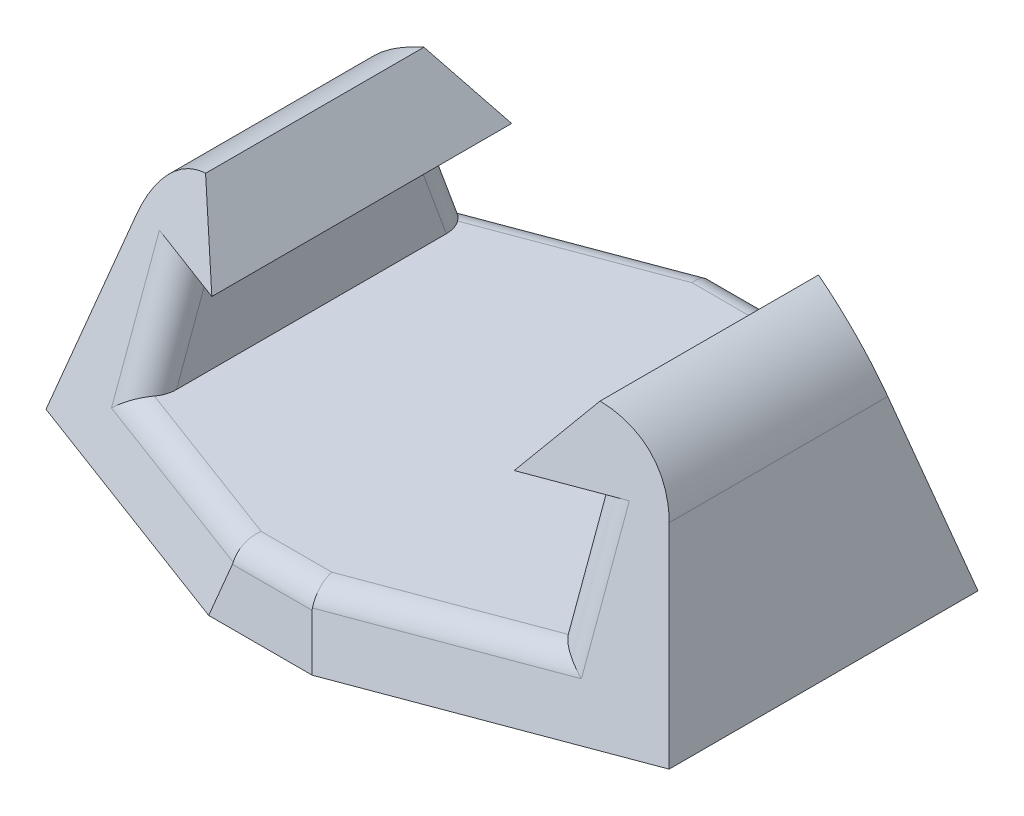
from build123d import *

# Parameters (mm, degrees)
EXTRUDE_1_DEPTH          = 20
CUT_EXTRUDE_1_DEPTH      = 26.52668646
CUT_EXTRUDE_1_DEPTH_BACK = 26.52668646
FILLET_1_R               = 4
CHAMFER_1_SIZE           = 10
CHAMFER_1_SIZE_2         = 3.739269956
FILLET_2_R               = 1


with BuildPart() as part:
    # 草圖2 → 填料-伸長1 (new body)
    with BuildSketch(Plane.XY):
        Polygon((-8.195537152, 3.678491207), (-10.195537152, 3.678491207), (-10.195537152, -0.821508793), (5.804462848, -0.821508793), (5.804462848, 3.678491207), (3.804462848, 3.678491207), (5.618474025, 6.178491207), (7.618474025, 6.178491207), (10.163991353, -3.321508793), (-14.609516351, -3.321508793), (-12.063999023, 6.178491207), (-10.063999023, 6.178491207), align=None)
    extrude(amount=EXTRUDE_1_DEPTH)

    # 草圖3 → 除料-伸長1 (cut, two sides: drawn at the far end of the back side and taken through both)
    with BuildSketch(Plane(origin=(0, 0, 0), x_dir=(0, 0, -1), z_dir=(1, 0, 0)).offset(-CUT_EXTRUDE_1_DEPTH_BACK)):
        Polygon((-20, -3.321508793), (-17.454482672, 6.178491207), (-20, 6.178491207), align=None)
        Polygon((0, 6.178491207), (-2.545517328, 6.178491207), (0, -3.321508793), align=None)
    extrude(amount=CUT_EXTRUDE_1_DEPTH + CUT_EXTRUDE_1_DEPTH_BACK, mode=Mode.SUBTRACT)

    # 圓角1
    # the kernel refuses this fillet: 4 mm, written as the material it takes off along each edge
    with BuildSketch(Plane(origin=(7.618474025, 6.178491207, -4.720017408), x_dir=(-1, 0, 0), z_dir=(0, 0, 1))) as fillet_1_piece_1:
        with BuildLine():
            CenterArc((3.1115198, 3.842463238), FILLET_1_R, 195, 58.866285833)
            Line((-0.752183505, 2.807187057), (-0.829457571, 2.786481534))
            Line((-0.829457571, 2.786481534), (-0.077274066, -0.020705524))
            Line((-0.077274066, -0.020705524), (0, -0.08))
            ThreePointArc((0, -0.08), (1, -0.08), (1.977769604, -0.076849265))
            Line((1.977769604, -0.076849265), (2, 0))
        make_face()
    extrude(amount=29.440034816, mode=Mode.SUBTRACT)
    with BuildSketch(Plane(origin=(-12.063999023, 6.178491207, -4.720017408), x_dir=(1, 0, 0), z_dir=(0, 0, 1))) as fillet_1_piece_2:
        with BuildLine():
            CenterArc((3.1115198, -3.842463238), FILLET_1_R, 106.133714167, 58.866285833)
            Line((-0.752183505, -2.807187057), (-0.829457571, -2.786481534))
            Line((-0.829457571, -2.786481534), (-0.077274066, 0.020705524))
            Line((-0.077274066, 0.020705524), (0, 0.08))
            ThreePointArc((0, 0.08), (1, 0.08), (1.977769604, 0.076849265))
            Line((1.977769604, 0.076849265), (2, 0))
        make_face()
    extrude(amount=29.440034816, mode=Mode.SUBTRACT)

    # 導角1
    # the kernel refuses this chamfer: 10, 3.739269956 mm, written as the material it takes off along each edge
    with BuildSketch(Plane(origin=(16.664078496, -27.580164265, -6.500087143), x_dir=(-0.9680162049238082, -0.23859176587740763, -0.07757961240176374), z_dir=(-0.25056280708573614, 0.9351131265310298, 0.25056280708572526)), Plane(origin=(-6.316095385, 27.629959622, 8.293420966), x_dir=(0.9680162049238085, -0.23859176587740732, -0.0775796124017635), z_dir=(-0.2505628070857358, -0.93511312653103, -0.2505628070857253)), Plane(origin=(-21.109603495, -27.580164265, 26.500087143), x_dir=(0.9680162049238082, -0.23859176587740735, 0.07757961240176349), z_dir=(0.25056280708573586, 0.9351131265310301, -0.2505628070857251)), Plane(origin=(1.870570387, 27.629959622, 11.706579034), x_dir=(-0.9680162049238082, -0.23859176587740777, 0.07757961240176336), z_dir=(0.25056280708573614, -0.93511312653103, 0.25056280708572504))) as chamfer_1_piece_1:
        Polygon((CHAMFER_1_SIZE * 0.999913086528, CHAMFER_1_SIZE * 0.0131840581986), (-CHAMFER_1_SIZE_2 * 0.080135920558, CHAMFER_1_SIZE_2 * 0.996783945724), (0, 0), align=None)
    extrude(amount=59.041117401, mode=Mode.SUBTRACT)

    # 圓角2
    fillet_2_edges = [part.edges().sort_by_distance(p)[0] for p in [
        (5.804462848, 1.428491207, 16.018986119),
        (5.804462848, 1.428491207, 3.981013881),
        (-2.222762499, -0.821508793, 19.330127019),
        (-2.222762499, -0.821508793, 0.669872981),
        (2.484536748, -0.821508793, 18.088717027),
        (-6.902836399, -0.821508793, 18.098897319),
        (-6.902836399, -0.821508793, 1.901102681),
        (2.484536748, -0.821508793, 1.911282973),
        (-10.195537152, 1.428491207, 16.039346704),
        (-10.195537152, 1.428491207, 3.960653296),
    ]]
    fillet(fillet_2_edges, radius=FILLET_2_R)


solid = part.part
